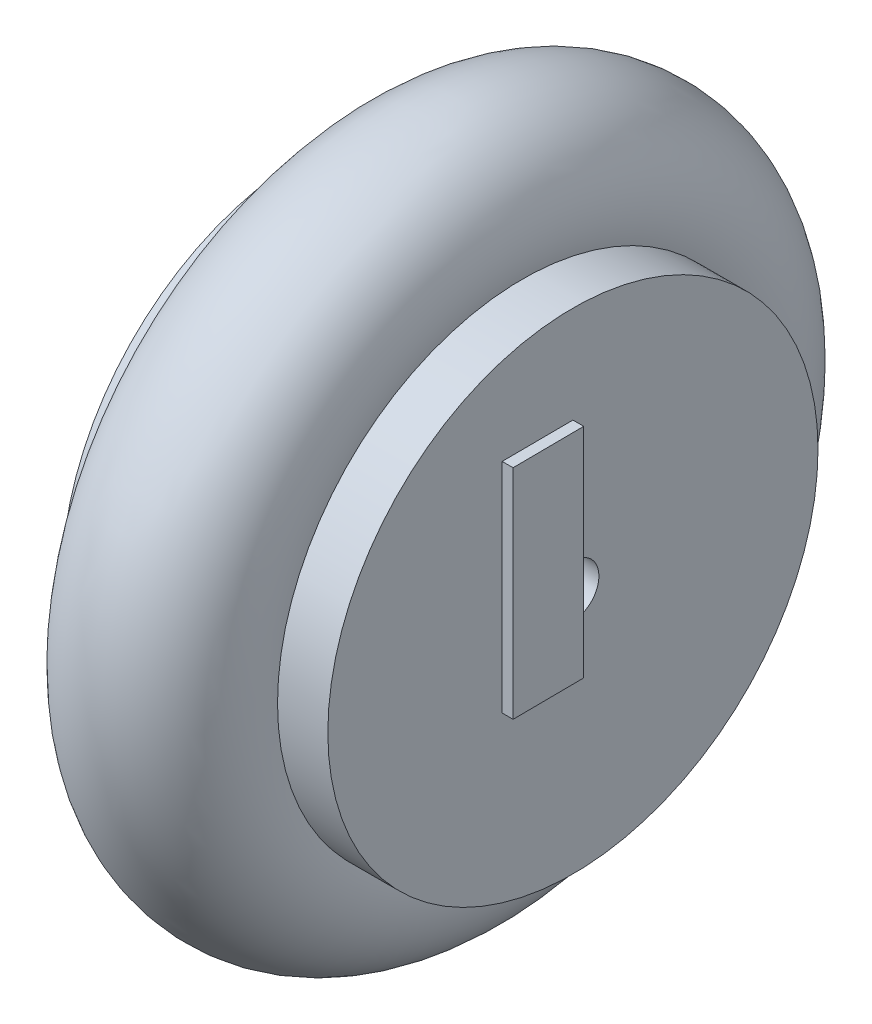
from build123d import *

# Parameters (mm, degrees)
SWEEP2_PROFILE_R = 7.62


with BuildPart() as part:
    # Boundary3: read off the stored shape, not the designer's step
    # Boundary3: loft between two sections, ruled curve by curve
    boundary3_from = [
        Edge.make_line((-10.16, 12.175576631, 0), (-10.16, -6.00529912, 0)),
        Edge.make_line((-10.16, -6.00529912, 0), (12.7, -6.00529912, 0)),
        Edge.make_line((12.7, -6.00529912, 0), (12.7, 12.73038731, 0)),
        Edge.make_line((12.7, 12.73038731, 0), (7.62, 12.73038731, 0)),
        Edge.make_line((7.62, 12.73038731, 0), (2.54, 0, 0)),
        Edge.make_line((2.54, 0, 0), (0, 0, 0)),
        Edge.make_line((0, 0, 0), (-5.08, 12.175576631, 0)),
        Edge.make_line((-5.08, 12.175576631, 0), (-10.16, 12.175576631, 0)),
    ]
    boundary3_to = [
        Edge.make_line((-10.147545464, 12.140427218, 6.083823129), (-10.147545464, -6.040448532, 6.083823129)),
        Edge.make_line((-10.147545464, -6.040448532, 6.083823129), (12.712454536, -6.040448532, 6.083823129)),
        Edge.make_line((12.712454536, -6.040448532, 6.083823129), (12.712454536, 12.695237898, 6.083823129)),
        Edge.make_line((12.712454536, 12.695237898, 6.083823129), (7.632454536, 12.695237898, 6.083823129)),
        Edge.make_line((7.632454536, 12.695237898, 6.083823129), (2.552454536, -0.035149412, 6.083823129)),
        Edge.make_line((2.552454536, -0.035149412, 6.083823129), (0.012454536, -0.035149412, 6.083823129)),
        Edge.make_line((0.012454536, -0.035149412, 6.083823129), (-5.067545464, 12.140427218, 6.083823129)),
        Edge.make_line((-5.067545464, 12.140427218, 6.083823129), (-10.147545464, 12.140427218, 6.083823129)),
    ]
    boundary3 = Solid(Shell([*[Face.make_surface_from_curves(boundary3_from[k], boundary3_to[k]) for k in range(8)], Face(Wire(boundary3_from)), Face(Wire(boundary3_to))]))
    add(boundary3)


with BuildPart() as body_2:
    # Sketch2 → Revolve2 (revolve)
    with BuildSketch(Plane.XY, mode=Mode.PRIVATE) as revolve2_sk:
        Polygon((-11.087525715, 21.073570044), (-6.007525715, 21.073570044), (-0.927525715, 15.273308854), (1.612474285, 15.273308854), (6.692474285, 21.073570044), (11.772474285, 21.073570044), (11.772474285, 2.234828231), (-11.087525715, 2.234828231), align=None)
    revolve(revolve2_sk.sketch.rotate(Axis((-11.087525715, 0, 0), (1, 0, 0)), 90), axis=Axis((-11.087525715, 0, 0), (1, 0, 0)))

    # Sweep2: sweep along a path in Sketch3
    with BuildLine(Plane(origin=(0, 0, 0), x_dir=(0, 0, -1), z_dir=(1, 0, 0))) as sweep2_path:
        CenterArc((0, 0), 22.689926061, 0, 360)
    # Sweep2 profile (on start of the path) → Sweep2 (sweep)
    with BuildSketch(Plane(origin=(0, 0, -22.689926061), x_dir=(0, 0, 1), z_dir=(0, 1, 0))):
        Circle(SWEEP2_PROFILE_R)
    sweep(path=sweep2_path.line)


solid = Compound([part.part, body_2.part])
